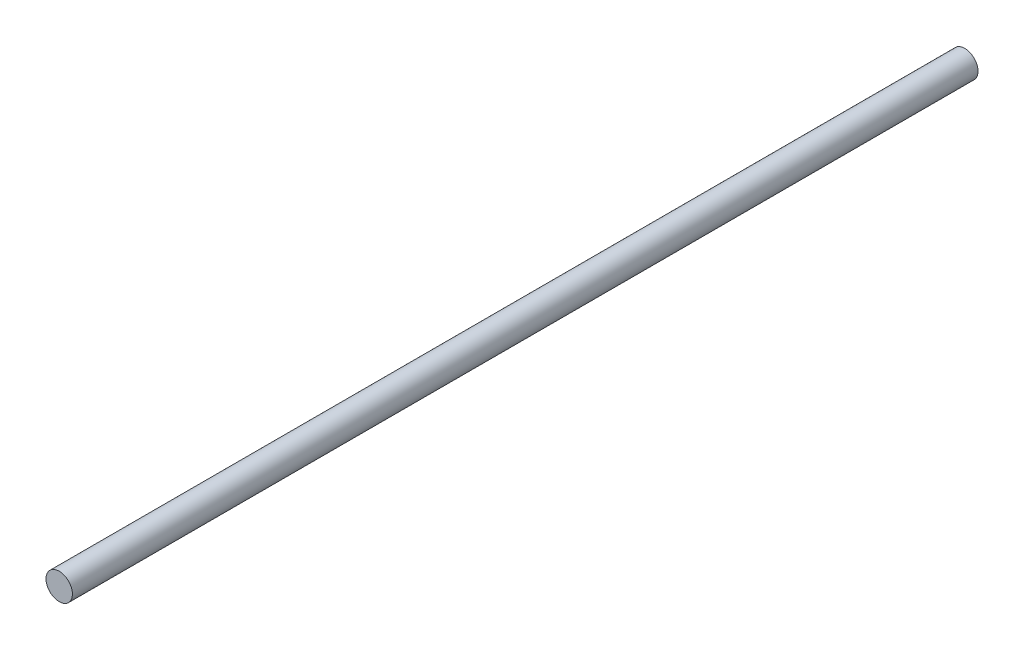
from build123d import *

# Parameters (mm, degrees)
ESQUISSE1_R        = 2.45
BOSS_EXTRU_1_DEPTH = 168


with BuildPart() as part:
    # Esquisse1 → Boss.-Extru.1 (new body)
    with BuildSketch(Plane.XY):
        Circle(ESQUISSE1_R)
    extrude(amount=BOSS_EXTRU_1_DEPTH)


solid = part.part
